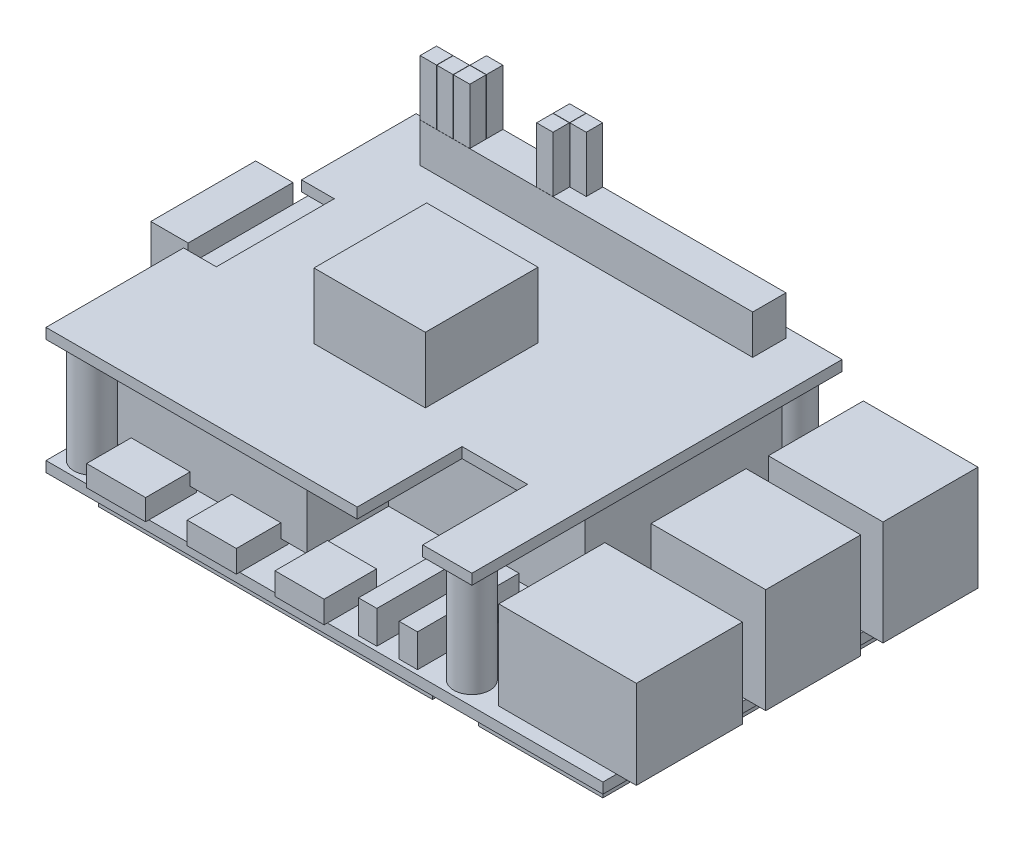
from build123d import *

# Parameters (mm, degrees)
SKETCH1_W                                 = 85
SKETCH1_H                                 = 56
PI_5_PCB_DEPTH                            = 1.6
SKETCH2_W                                 = 51
SKETCH2_H                                 = 54
UNDERSIDE_PARTS_1_DEPTH                   = 1.5
SKETCH3_W                                 = 83
SKETCH3_H                                 = 42
UNDERSIDE_PARTS_2_DEPTH                   = 1.5
SKETCH4_W                                 = 19
SKETCH4_H                                 = 54
UNDERSIDE_PARTS_3_DEPTH                   = 1.5
SKETCH5_W                                 = 16.5
SKETCH5_H                                 = 12
MICROSD_CARD_DEPTH                        = 1.5
SKETCH6_W                                 = 33.5
SKETCH6_H                                 = 42.5
COOLER_FINS_DEPTH                         = 13.7
SKETCH7_W                                 = 30
SKETCH7_H                                 = 30
COOLER_FAN_DEPTH                          = 13.7
SKETCH8_W                                 = 50.8
SKETCH8_H                                 = 5.08
F_40_PIN_HEADER_AND_STACKING_SOCKET_DEPTH = 16
SKETCH9_R                                 = 2.75
HAT_SPACER_1_DEPTH                        = 16
SKETCH10_R                                = 2.75
HAT_SPACER_2_DEPTH                        = 16
SKETCH11_R                                = 2.75
HAT_SPACER_3_DEPTH                        = 16
SKETCH12_R                                = 2.75
HAT_SPACER_4_DEPTH                        = 16
AI_HAT_PCB_DEPTH                          = 1.6
SKETCH14_W                                = 17
SKETCH14_H                                = 17.2
HAILO_AND_HEATSINK_DEPTH                  = 10
SKETCH15_W                                = 50.8
SKETCH15_H                                = 5.08
STACKING_PINS_DEPTH                       = 6
SKETCH16_W                                = 2.5
SKETCH16_H                                = 2.5
DUPONT_HOUSINGS_DEPTH                     = 14
SKETCH17_W                                = 5.7
SKETCH17_H                                = 16
PCIE_FLAT_CABLE_LOOP_DEPTH                = 18.6
SKETCH18_W                                = 21
SKETCH18_H                                = 16.2
ETHERNET_DEPTH                            = 13.5
SKETCH19_W                                = 17.5
SKETCH19_H                                = 14.5
USB_A_STACKS_DEPTH                        = 16
SKETCH20_W                                = 9
SKETCH20_H                                = 7.8
USB_C_DEPTH                               = 3.2
SKETCH21_W                                = 7.5
SKETCH21_H                                = 8
MICRO_HDMI_DEPTH                          = 3.4
SKETCH22_W                                = 2.8
SKETCH22_H                                = 15.5
CAM_DISP_CONNECTORS_DEPTH                 = 5


with BuildPart() as part:
    # Sketch1 → Pi 5 PCB (new body)
    with BuildSketch(Plane(origin=(0, -16, 0), x_dir=(1, 0, 0), z_dir=(0, 1, 0))):
        with Locations((-12.5, -64.5)):
            Rectangle(SKETCH1_W, SKETCH1_H)
    extrude(amount=PI_5_PCB_DEPTH)

    # Sketch2 → Underside Parts 1 (add)
    with BuildSketch(Plane(origin=(0, -17.5, 0), x_dir=(1, 0, 0), z_dir=(0, 1, 0))):
        with Locations((-22.5, -64.5)):
            Rectangle(SKETCH2_W, SKETCH2_H)
    extrude(amount=UNDERSIDE_PARTS_1_DEPTH)

    # Sketch3 → Underside Parts 2 (add)
    with BuildSketch(Plane(origin=(0, -17.5, 0), x_dir=(1, 0, 0), z_dir=(0, 1, 0))):
        with Locations((-12.5, -64.5)):
            Rectangle(SKETCH3_W, SKETCH3_H)
    extrude(amount=UNDERSIDE_PARTS_2_DEPTH)

    # Sketch4 → Underside Parts 3 (add)
    with BuildSketch(Plane(origin=(0, -17.5, 0), x_dir=(1, 0, 0), z_dir=(0, 1, 0))):
        with Locations((19.5, -64.5)):
            Rectangle(SKETCH4_W, SKETCH4_H)
    extrude(amount=UNDERSIDE_PARTS_3_DEPTH)

    # Sketch5 → microSD Card (add)
    with BuildSketch(Plane(origin=(0, -17.5, 0), x_dir=(1, 0, 0), z_dir=(0, 1, 0))):
        with Locations((-49.25, -64.5)):
            Rectangle(SKETCH5_W, SKETCH5_H)
    extrude(amount=MICROSD_CARD_DEPTH)

    # Sketch8 → 40-pin Header And Stacking Socket (add)
    with BuildSketch(Plane(origin=(0, -14.4, 0), x_dir=(1, 0, 0), z_dir=(0, 1, 0))):
        with Locations((-22.5, -40)):
            Rectangle(SKETCH8_W, SKETCH8_H)
    extrude(amount=F_40_PIN_HEADER_AND_STACKING_SOCKET_DEPTH)

    # Sketch9 → HAT Spacer 1 (add)
    with BuildSketch(Plane(origin=(0, -14.4, 0), x_dir=(1, 0, 0), z_dir=(0, 1, 0))):
        with Locations((-51.5, -89)):
            Circle(SKETCH9_R)
    extrude(amount=HAT_SPACER_1_DEPTH)

    # Sketch10 → HAT Spacer 2 (add)
    with BuildSketch(Plane(origin=(0, -14.4, 0), x_dir=(1, 0, 0), z_dir=(0, 1, 0))):
        with Locations((6.5, -89)):
            Circle(SKETCH10_R)
    extrude(amount=HAT_SPACER_2_DEPTH)

    # Sketch11 → HAT Spacer 3 (add)
    with BuildSketch(Plane(origin=(0, -14.4, 0), x_dir=(1, 0, 0), z_dir=(0, 1, 0))):
        with Locations((-51.5, -40)):
            Circle(SKETCH11_R)
    extrude(amount=HAT_SPACER_3_DEPTH)

    # Sketch12 → HAT Spacer 4 (add)
    with BuildSketch(Plane(origin=(0, -14.4, 0), x_dir=(1, 0, 0), z_dir=(0, 1, 0))):
        with Locations((6.5, -40)):
            Circle(SKETCH12_R)
    extrude(amount=HAT_SPACER_4_DEPTH)

    # Sketch13 → AI HAT+ PCB (add)
    with BuildSketch(Plane(origin=(0, 1.6, 0), x_dir=(1, 0, 0), z_dir=(0, 1, 0))):
        Polygon((-55, -92.5), (-7.5, -92.5), (-7.5, -76.5), (2.5, -76.5), (2.5, -92.5), (10, -92.5), (10, -36), (-55, -36), (-55, -53.5), (-50, -53.5), (-50, -71.5), (-55, -71.5), align=None)
    extrude(amount=AI_HAT_PCB_DEPTH)

    # Sketch14 → Hailo And Heatsink (add)
    with BuildSketch(Plane(origin=(0, 3.2, 0), x_dir=(1, 0, 0), z_dir=(0, 1, 0))):
        with Locations((-23.9, -65.6)):
            Rectangle(SKETCH14_W, SKETCH14_H)
    extrude(amount=HAILO_AND_HEATSINK_DEPTH)

    # Sketch15 → Stacking Pins (add)
    with BuildSketch(Plane(origin=(0, 3.2, 0), x_dir=(1, 0, 0), z_dir=(0, 1, 0))):
        with Locations((-22.5, -40)):
            Rectangle(SKETCH15_W, SKETCH15_H)
    extrude(amount=STACKING_PINS_DEPTH)

    # Sketch16 → Dupont Housings (add)
    with BuildSketch(Plane(origin=(0, 3.7, 0), x_dir=(1, 0, 0), z_dir=(0, 1, 0))):
        with Locations((-46.63, -41.27)):
            Rectangle(SKETCH16_W, SKETCH16_H)
        with Locations((-44.09, -41.27)):
            Rectangle(SKETCH16_W, SKETCH16_H)
        with Locations((-41.55, -41.27)):
            Rectangle(SKETCH16_W, SKETCH16_H)
        with Locations((-41.55, -38.73)):
            Rectangle(SKETCH16_W, SKETCH16_H)
        with Locations((-28.85, -41.27)):
            Rectangle(SKETCH16_W, SKETCH16_H)
        with Locations((-28.85, -38.73)):
            Rectangle(SKETCH16_W, SKETCH16_H)
        with Locations((-26.31, -38.73)):
            Rectangle(SKETCH16_W, SKETCH16_H)
    extrude(amount=DUPONT_HOUSINGS_DEPTH)

    # Sketch18 → Ethernet (add)
    with BuildSketch(Plane(origin=(0, -14.4, 0), x_dir=(1, 0, 0), z_dir=(0, 1, 0))):
        with Locations((22.5, -82.3)):
            Rectangle(SKETCH18_W, SKETCH18_H)
    extrude(amount=ETHERNET_DEPTH)

    # Sketch19 → USB-A Stacks (add)
    with BuildSketch(Plane(origin=(0, -14.4, 0), x_dir=(1, 0, 0), z_dir=(0, 1, 0))):
        with Locations((24.25, -63.4)):
            Rectangle(SKETCH19_W, SKETCH19_H)
        with Locations((24.25, -45.5)):
            Rectangle(SKETCH19_W, SKETCH19_H)
    extrude(amount=USB_A_STACKS_DEPTH)



with BuildPart() as body_2:
    # Sketch6 → Cooler Fins (new body)
    with BuildSketch(Plane(origin=(0, -13.1, 0), x_dir=(1, 0, 0), z_dir=(0, 1, 0))):
        with Locations((-38.25, -64.95)):
            Rectangle(SKETCH6_W, SKETCH6_H)
    extrude(amount=COOLER_FINS_DEPTH)

    # Sketch7 → Cooler Fan (add)
    with BuildSketch(Plane(origin=(0, -13.1, 0), x_dir=(1, 0, 0), z_dir=(0, 1, 0))):
        with Locations((-6.5, -58.7)):
            Rectangle(SKETCH7_W, SKETCH7_H)
    extrude(amount=COOLER_FAN_DEPTH)


with BuildPart() as body_3:
    # Sketch17 → PCIe Flat Cable Loop (new body)
    with BuildSketch(Plane(origin=(0, -15.4, 0), x_dir=(1, 0, 0), z_dir=(0, 1, 0))):
        with Locations((-58.15, -62.5)):
            Rectangle(SKETCH17_W, SKETCH17_H)
    extrude(amount=PCIE_FLAT_CABLE_LOOP_DEPTH)


with BuildPart() as part_1:
    add(part.part)

    add(body_2.part)  # USB-C merges body 2
    # Sketch20 → USB-C (add)
    with BuildSketch(Plane(origin=(0, -14.4, 0), x_dir=(1, 0, 0), z_dir=(0, 1, 0))):
        with Locations((-43.8, -89.1)):
            Rectangle(SKETCH20_W, SKETCH20_H)
    extrude(amount=USB_C_DEPTH)

    # Sketch21 → Micro-HDMI (add)
    with BuildSketch(Plane(origin=(0, -14.4, 0), x_dir=(1, 0, 0), z_dir=(0, 1, 0))):
        with Locations((-29.2, -89)):
            Rectangle(SKETCH21_W, SKETCH21_H)
        with Locations((-15.8, -89)):
            Rectangle(SKETCH21_W, SKETCH21_H)
    extrude(amount=MICRO_HDMI_DEPTH)

    # Sketch22 → CAM-DISP Connectors (add)
    with BuildSketch(Plane(origin=(0, -14.4, 0), x_dir=(1, 0, 0), z_dir=(0, 1, 0))):
        with Locations((-6.6, -84.05)):
            Rectangle(SKETCH22_W, SKETCH22_H)
        with Locations((-0.4, -84.05)):
            Rectangle(SKETCH22_W, SKETCH22_H)
    extrude(amount=CAM_DISP_CONNECTORS_DEPTH)


solid = Compound([body_3.part, part_1.part])
